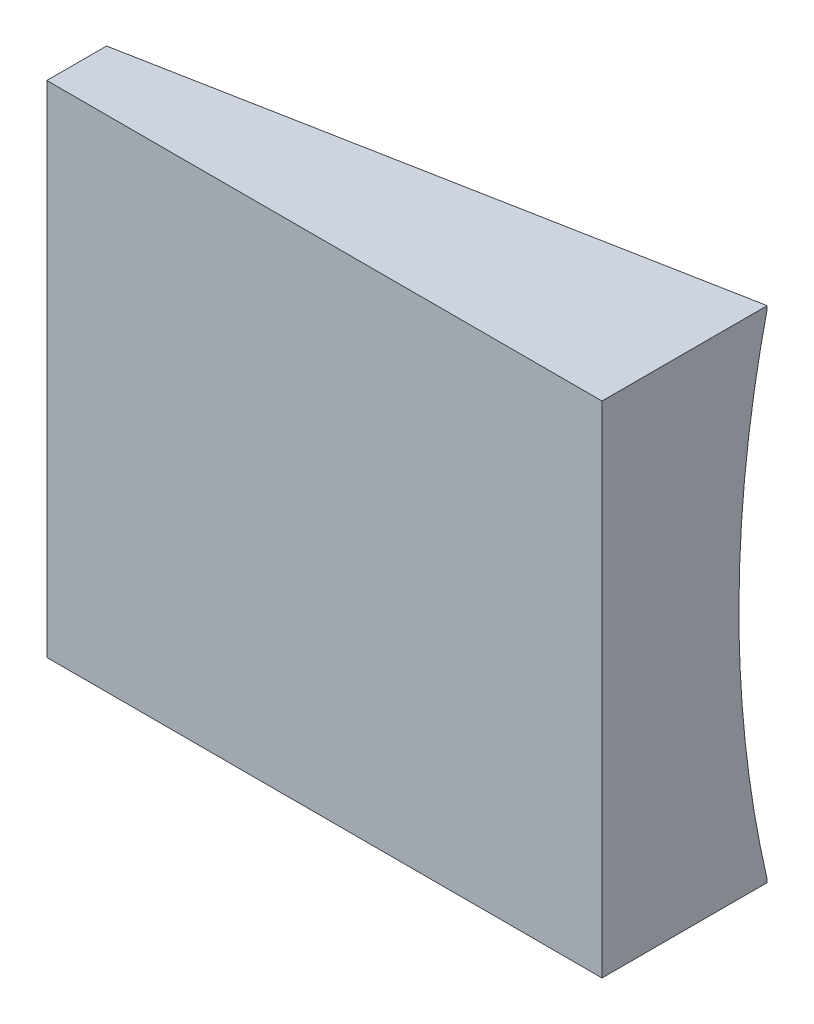
from build123d import *

# Parameters (mm, degrees)
ESQUISSE1_W                  = 20
ESQUISSE1_H                  = 18
BOSS_EXTRU_1_DEPTH           = 6
ENL_V_MAT_EXTRU_1_DEPTH      = 28.568097504
ENL_V_MAT_EXTRU_1_DEPTH_BACK = 28.568097504
ESQUISSE4_W                  = 20.759147063
ESQUISSE4_H                  = 17.8
ENL_V_MAT_EXTRU_3_DEPTH      = 1
CONG_2_R                     = 40


with BuildPart() as part:
    # Esquisse1 → Boss.-Extru.1 (new body)
    with BuildSketch(Plane.XY):
        with Locations((10, 3)):
            Rectangle(ESQUISSE1_W, ESQUISSE1_H)
    extrude(amount=BOSS_EXTRU_1_DEPTH)

    # Esquisse2 → Enlèv. mat.-Extru.1 (cut, two sides: drawn at the far end of the back side and taken through both)
    with BuildSketch(Plane(origin=(0, 12, 0), x_dir=(1, 0, 0), z_dir=(0, 1, 0)).offset(-ENL_V_MAT_EXTRU_1_DEPTH_BACK)):
        Polygon((70.960283861, 9.63154869), (20.045630921, -0.0408989), (0, -3.849042594), (0, 0), (0, 51.825265329), (52.974270305, 140.916001049), (123.934554166, 98.72228441), align=None)
    extrude(amount=ENL_V_MAT_EXTRU_1_DEPTH + ENL_V_MAT_EXTRU_1_DEPTH_BACK, mode=Mode.SUBTRACT)

    # Esquisse4 → Enlèv. mat.-Extru.3 (cut)
    with BuildSketch(Plane(origin=(0.705746644, 0, 3.714969257), x_dir=(-0.9824291803850712, 0, 0.1866357562952965), z_dir=(-0.1866357562952965, 0, -0.9824291803850712))):
        with Locations((-9.259758994, 3)):
            Rectangle(ESQUISSE4_W, ESQUISSE4_H)
    extrude(amount=-ENL_V_MAT_EXTRU_3_DEPTH, mode=Mode.SUBTRACT)

    # Congé2
    # the kernel refuses this fillet: 40 mm, written as the material it adds along each edge
    with BuildSketch(Plane(origin=(41.830053891, 11.9, -3.079684565), x_dir=(0, -1, 0), z_dir=(-0.9824291803850712, 0, 0.1866357562952965))) as cong_2_piece_1_section:
        with BuildLine():
            CenterArc((8.888194417, -40), CONG_2_R, 90, 12.838568141)
            Line((0, -1), (0, 0))
            Line((0, 0), (8.888194417, 0))
        make_face()
    cong_2_piece_1 = extrude(amount=64.798673587, mode=Mode.PRIVATE)
    cong_2_piece_1 = split(cong_2_piece_1, bisect_by=Plane(origin=(20, 11.9, -3.079684565), z_dir=(-1, 0, 0)), keep=Keep.TOP, mode=Mode.PRIVATE)
    cong_2_piece_1 = split(cong_2_piece_1, bisect_by=Plane(origin=(0, 11.9, -3.079684565), z_dir=(1, 0, 0)), keep=Keep.TOP, mode=Mode.PRIVATE)
    add(cong_2_piece_1)
    with BuildSketch(Plane(origin=(-21.830053891, -5.9, 9.014064887), x_dir=(-0.1866357562952965, 0, -0.9824291803850712), z_dir=(0.9824291803850712, 0, -0.1866357562952965))) as cong_2_piece_2_section:
        with BuildLine():
            CenterArc((40, 8.888194417), CONG_2_R, 180, 12.838568141)
            Line((0, 8.888194417), (0, 0))
            Line((0, 0), (1, 0))
        make_face()
    cong_2_piece_2 = extrude(amount=64.798673587, mode=Mode.PRIVATE)
    cong_2_piece_2 = split(cong_2_piece_2, bisect_by=Plane(origin=(20, -5.9, 9.014064887), z_dir=(-1, 0, 0)), keep=Keep.TOP, mode=Mode.PRIVATE)
    cong_2_piece_2 = split(cong_2_piece_2, bisect_by=Plane(origin=(0, -5.9, 9.014064887), z_dir=(1, 0, 0)), keep=Keep.TOP, mode=Mode.PRIVATE)
    add(cong_2_piece_2)


solid = part.part
